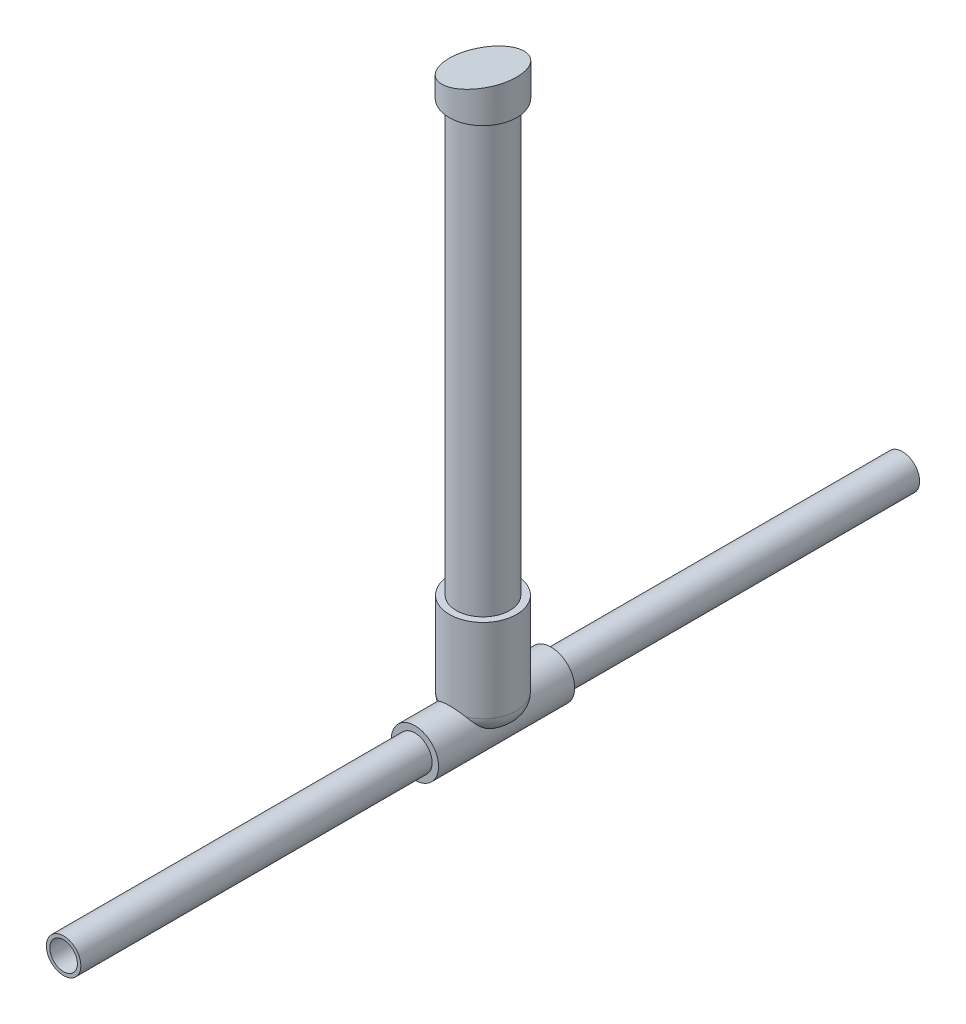
from build123d import *

# Parameters (mm, degrees)
SKETCH1_R                = 4.98475
SKETCH1_R_2              = 4.0005
BOSS_EXTRUDE1_DEPTH      = 242.57
BOSS_EXTRUDE2_START      = -39.37
SKETCH2_R                = 6.8326
SKETCH2_R_2              = 4.98475
BOSS_EXTRUDE2_DEPTH      = 39.37
BOSS_EXTRUDE3_DEPTH      = 22.86
BOSS_EXTRUDE3_DEPTH_BACK = 6.35
SKETCH4_R                = 9.7155
SKETCH5_R                = 7.747
CUT_EXTRUDE1_DEPTH       = 22.86
FILLET1_R                = 5.08
BOSS_EXTRUDE5_DEPTH      = 124.46
BOSS_EXTRUDE5_DEPTH_BACK = 15.24
SKETCH6_R                = 7.747
SKETCH6_R_2              = 6.9215
SKETCH7_R                = 9.779
BOSS_EXTRUDE6_DEPTH      = 10.16
CUT_EXTRUDE2_DEPTH       = 217.718250934


with BuildPart() as part:
    # Sketch1 → Boss-Extrude1 (new body)
    with BuildSketch(Plane.XY):
        Circle(SKETCH1_R)
        Circle(SKETCH1_R_2, mode=Mode.SUBTRACT)
    extrude(amount=BOSS_EXTRUDE1_DEPTH)

    # Sketch2 → Boss-Extrude2 (add)
    with BuildSketch(Plane.XY.offset(140.97).offset(BOSS_EXTRUDE2_START)):
        Circle(SKETCH2_R)
        Circle(SKETCH2_R_2, mode=Mode.SUBTRACT)
    extrude(amount=BOSS_EXTRUDE2_DEPTH)

    # Sketch4 → Boss-Extrude3 (add, two sides: drawn at the far end of the back side and taken through both)
    with BuildSketch(Plane(origin=(0, 6.8326, 0), x_dir=(1, 0, 0), z_dir=(0, 1, 0)).offset(-BOSS_EXTRUDE3_DEPTH_BACK)):
        with Locations(Location((0, -121.285, 0), (0, 0, 270))):
            Circle(SKETCH4_R)
    extrude(amount=BOSS_EXTRUDE3_DEPTH + BOSS_EXTRUDE3_DEPTH_BACK)

    # Sketch5 → Cut-Extrude1 (cut)
    with BuildSketch(Plane(origin=(0, 29.6926, 0), x_dir=(1, 0, 0), z_dir=(0, 1, 0))):
        with Locations(Location((0, -121.285, 0), (0, 0, 270))):
            Circle(SKETCH5_R)
    extrude(amount=-CUT_EXTRUDE1_DEPTH, mode=Mode.SUBTRACT)

    # Fillet1
    # the kernel refuses this fillet: 5.08 mm, written as the material it adds along each edge
    # the kernel refuses this fillet: 5.08 mm, written as the material it takes off along each edge
    with BuildSketch(Plane(origin=(0, 0.4826, 121.285), x_dir=(-0.9876010870599544, 0, -0.1569843713176455), z_dir=(0.1569843713176455, 0, -0.9876010870599544))) as fillet1_2_piece_1_section:
        with BuildLine():
            CenterArc((9.7155 - FILLET1_R, FILLET1_R), FILLET1_R, 270, 90)
            Line((9.7155 - FILLET1_R, 0), (9.7155, 0))
            Line((9.7155, 0), (9.7155, FILLET1_R))
        make_face()
    fillet1_2_piece_1 = revolve(axis=Axis((0, 0.4826, 121.285), (0, 1, 0)), revolution_arc=198.063802919, mode=Mode.PRIVATE)
    fillet1_2_piece_1 = fillet1_2_piece_1 - Plane(origin=(0, 0, 123.780869726), x_dir=(1, 0, 0), z_dir=(0, 0, -1)) * Cylinder(6.8326, 39, mode=Mode.PRIVATE)
    add(fillet1_2_piece_1, mode=Mode.SUBTRACT)
    with BuildSketch(Plane(origin=(0, 0.4826, 121.285), x_dir=(0.9876010870599545, 0, 0.15698437131764403), z_dir=(-0.15698437131764403, 0, 0.9876010870599545))) as fillet1_2_piece_2_section:
        with BuildLine():
            CenterArc((9.7155 - FILLET1_R, FILLET1_R), FILLET1_R, 270, 90)
            Line((9.7155, FILLET1_R), (9.7155, 0))
            Line((9.7155, 0), (9.7155 - FILLET1_R, 0))
        make_face()
    fillet1_2_piece_2 = revolve(axis=Axis((0, 0.4826, 121.285), (0, 1, 0)), revolution_arc=198.063802919, mode=Mode.PRIVATE)
    fillet1_2_piece_2 = fillet1_2_piece_2 - Plane(origin=(0, 0, 118.789130045), x_dir=(1, 0, 0), z_dir=(0, 0, -1)) * Cylinder(6.8326, 39, mode=Mode.PRIVATE)
    add(fillet1_2_piece_2, mode=Mode.SUBTRACT)
    with BuildSketch(Plane(origin=(0, 0.4826, 121.285), x_dir=(-0.505713651379917, 0, 0.8627013984038694), z_dir=(-0.8627013984038694, 0, -0.505713651379917))) as fillet1_2_piece_3_section:
        with BuildLine():
            CenterArc((9.7155 - FILLET1_R, FILLET1_R), FILLET1_R, 270, 90)
            Line((9.7155 - FILLET1_R, 0), (9.7155, 0))
            Line((9.7155, 0), (9.7155, FILLET1_R))
        make_face()
    fillet1_2_piece_3 = revolve(axis=Axis((0, 0.4826, 121.285), (0, 1, 0)), revolution_arc=240.757475194, mode=Mode.PRIVATE)
    fillet1_2_piece_3 = fillet1_2_piece_3 - Plane(origin=(0, 0, 129.754845305), x_dir=(1, 0, 0), z_dir=(0, 0, -1)) * Cylinder(6.8326, 39, mode=Mode.PRIVATE)
    add(fillet1_2_piece_3, mode=Mode.SUBTRACT)
    with BuildSketch(Plane(origin=(0, 0.4826, 121.285), x_dir=(0.5057136513799171, 0, -0.8627013984038694), z_dir=(0.8627013984038694, 0, 0.5057136513799171))) as fillet1_2_piece_4_section:
        with BuildLine():
            CenterArc((9.7155 - FILLET1_R, FILLET1_R), FILLET1_R, 270, 90)
            Line((9.7155 - FILLET1_R, 0), (9.7155, 0))
            Line((9.7155, 0), (9.7155, FILLET1_R))
        make_face()
    fillet1_2_piece_4 = revolve(axis=Axis((0, 0.4826, 121.285), (0, 1, 0)), revolution_arc=240.757475194, mode=Mode.PRIVATE)
    fillet1_2_piece_4 = fillet1_2_piece_4 - Plane(origin=(0, 0, 112.815156077), x_dir=(1, 0, 0), z_dir=(0, 0, -1)) * Cylinder(6.8326, 39, mode=Mode.PRIVATE)
    add(fillet1_2_piece_4, mode=Mode.SUBTRACT)

    # Sketch6 → Boss-Extrude5 (add, two sides: drawn at the far end of the back side and taken through both)
    with BuildSketch(Plane(origin=(0, 29.6926, 0), x_dir=(1, 0, 0), z_dir=(0, 1, 0)).offset(-BOSS_EXTRUDE5_DEPTH_BACK)):
        with Locations(Location((0, -121.285, 0), (0, 0, 270))):
            Circle(SKETCH6_R)
        with Locations(Location((0, -121.285, 0), (0, 0, 270))):
            Circle(SKETCH6_R_2, mode=Mode.SUBTRACT)
    extrude(amount=BOSS_EXTRUDE5_DEPTH + BOSS_EXTRUDE5_DEPTH_BACK)

    # Sketch7 → Boss-Extrude6 (add)
    with BuildSketch(Plane(origin=(0, 154.1526, 0), x_dir=(1, 0, 0), z_dir=(0, 1, 0))):
        with Locations(Location((0, -121.285, 0), (0, 0, 270))):
            Circle(SKETCH7_R)
    extrude(amount=BOSS_EXTRUDE6_DEPTH)

    # Sketch8 → Cut-Extrude2 (cut, through all)
    with BuildSketch(Plane(origin=(0, 0, 101.6), x_dir=(-1, 0, 0), z_dir=(0, 0, -1))):
        Polygon((9.779, 164.3126), (-9.779, 164.3126), (9.779, 159.2326), align=None)
    extrude(amount=-CUT_EXTRUDE2_DEPTH, mode=Mode.SUBTRACT)


solid = part.part
